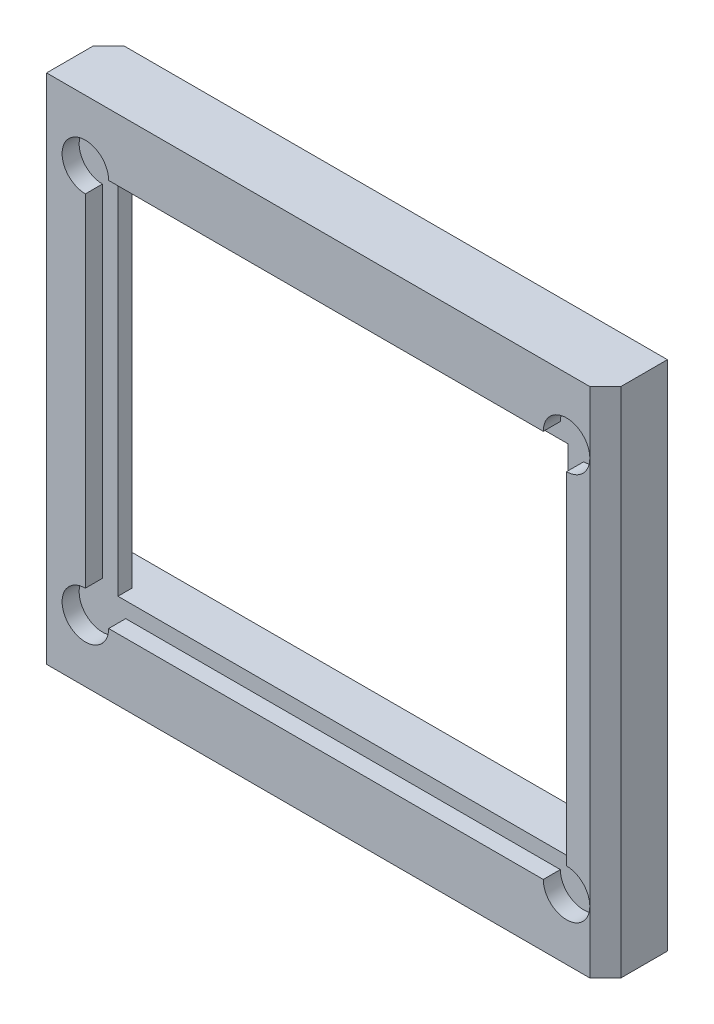
from build123d import *

# Parameters (mm, degrees)
SKETCH1_W                 = 36
SKETCH1_H                 = 33
BOSS_EXTRUDE1_DEPTH       = 4
SKETCH2_W                 = 31
SKETCH2_H                 = 25
CUT_EXTRUDE1_DEPTH        = 1.1
F_3_0MM_DOWEL_HOLE1_D     = 3
F_3_0MM_DOWEL_HOLE1_DEPTH = 1.1
SKETCH5_W                 = 29
SKETCH5_H                 = 23
CUT_EXTRUDE2_DEPTH        = 25.589835298
CHAMFER1_SIZE             = 2
CHAMFER2_SIZE             = 1
F_3_0MM_DOWEL_HOLE2_D     = 3
F_3_0MM_DOWEL_HOLE2_DEPTH = 3.5
F_3_0MM_DOWEL_HOLE2_TIP   = 0.901290929


# Read off the part's stored shape, not the designer's step: M2.5x0.45 Tapped Hole1
with BuildPart() as part:
    # Sketch1 → Boss-Extrude1 (new body)
    with BuildSketch(Plane.XY):
        Rectangle(SKETCH1_W, SKETCH1_H)
    extrude(amount=BOSS_EXTRUDE1_DEPTH)

    # Sketch2 → Cut-Extrude1 (cut)
    with BuildSketch(Plane.XY.offset(4)):
        Rectangle(SKETCH2_W, SKETCH2_H)
    extrude(amount=-CUT_EXTRUDE1_DEPTH, mode=Mode.SUBTRACT)

    # Ø3.0mm Dowel Hole1
    with Locations(Plane.XY.offset(4)):
        with Locations((-15.5, 12.5), (15.5, 12.5), (15.5, -12.5), (-15.5, -12.5)):
            Hole(F_3_0MM_DOWEL_HOLE1_D / 2, depth=F_3_0MM_DOWEL_HOLE1_DEPTH)

    # Sketch5 → Cut-Extrude2 (cut, through all)
    with BuildSketch(Plane.XY.offset(2.9)):
        Rectangle(SKETCH5_W, SKETCH5_H)
    extrude(amount=-CUT_EXTRUDE2_DEPTH, mode=Mode.SUBTRACT)

    # Chamfer1
    chamfer1_edges = [part.edges().sort_by_distance(p)[0] for p in [
        (14.5, 0, 0),
        (-14.5, 0, 0),
    ]]
    chamfer(chamfer1_edges, length=CHAMFER1_SIZE)

    # Chamfer2
    chamfer2_edges = [part.edges().sort_by_distance(p)[0] for p in [
        (18, 0, 4),
        (-18, 0, 0),
    ]]
    chamfer(chamfer2_edges, length=CHAMFER2_SIZE - 0.0001)  # a hair under: the kernel refuses the full size

    # Ø3.0mm Dowel Hole2
    with Locations(Plane(origin=(0, -16.5, 0), x_dir=(-1, 0, 0), z_dir=(0, -1, 0))):
        with Locations((12.5, -2), (-12.5, -2)):
            Hole(F_3_0MM_DOWEL_HOLE2_D / 2, depth=F_3_0MM_DOWEL_HOLE2_DEPTH)
            with Locations((0, 0, -(F_3_0MM_DOWEL_HOLE2_DEPTH + F_3_0MM_DOWEL_HOLE2_TIP / 2))):  # 118° drill point
                Cone(0, F_3_0MM_DOWEL_HOLE2_D / 2, F_3_0MM_DOWEL_HOLE2_TIP, mode=Mode.SUBTRACT)

    # M2.5x0.45 Tapped Hole1 outline → M2.5x0.45 Tapped Hole1 (revolve, cut)
    with BuildSketch(Plane.XY.offset(1.951410637)):
        Polygon((1.025, -13), (0, -12.384117865), (0, -16.5), (1.025, -16.5), align=None)
    revolve(axis=Axis((0, 0, 1.951410637), (0, 1, 0)), mode=Mode.SUBTRACT)


solid = part.part
